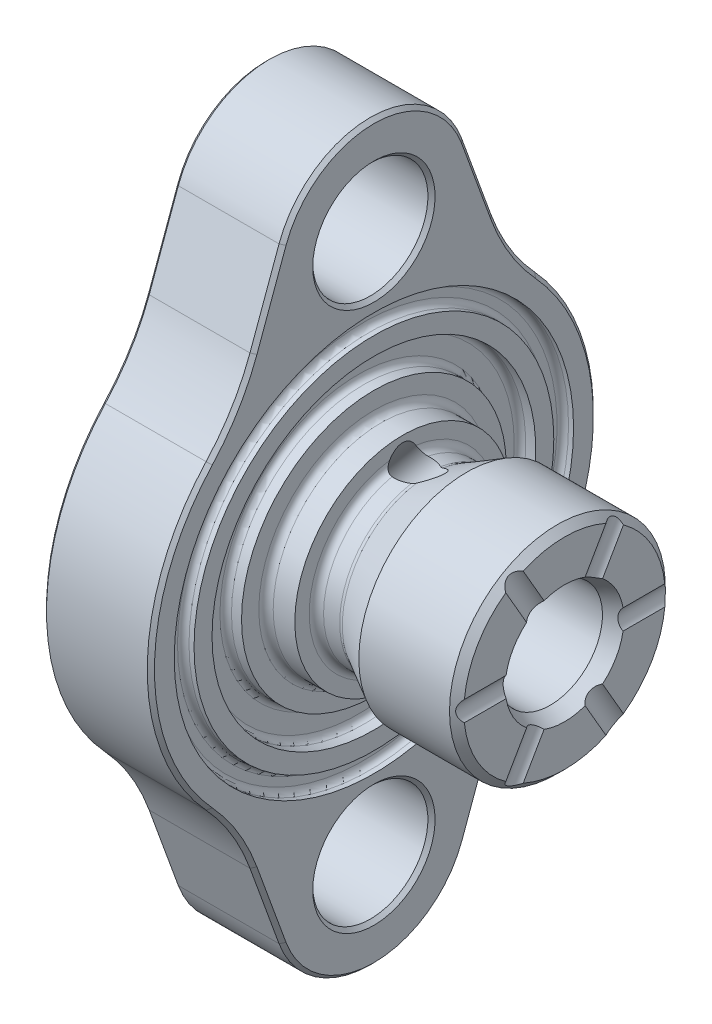
from build123d import *

# Parameters (mm, degrees)
SKETCH2_OUTSIDE_W  = 137.836
SKETCH2_OUTSIDE_H  = 137.836
CUT_EXTRUDE1_DEPTH = 86.057333605
SKETCH3_R          = 8
CUT_EXTRUDE2_DEPTH = 73.692846966
CHAMFER2_SIZE      = 1
CUT_EXTRUDE4_DEPTH = 73.692846966
CIRPATTERN1_COUNT  = 6
CIRPATTERN2_COUNT  = 2
SKETCH13_W         = 0.307692308
SKETCH13_H         = 1.153846154
SKETCH13_W_2       = 0.307692307
EXTRUDE1_DEPTH     = 0.1
CHAMFER3_SIZE      = 0.5


with BuildPart() as part:
    # Sketch1 → Revolve1 (revolve)
    with BuildSketch(Plane.XY):
        with BuildLine():
            Line((0, 0), (0, 52.5))
            Line((0, 52.5), (15, 52.5))
            Line((15, 52.5), (15, 27.75))
            Line((15, 27.75), (14.3, 27.75))
            ThreePointArc((14.3, 27.75), (13.734314575, 27.515685425), (13.5, 26.95))
            Line((13.5, 26.95), (13.5, 25.8))
            ThreePointArc((13.5, 25.8), (13.734314575, 25.234314575), (14.3, 25))
            Line((14.3, 25), (15, 25))
            Line((15, 25), (15, 22.5))
            Line((15, 22.5), (13.6, 22.5))
            ThreePointArc((13.6, 22.5), (13.034314575, 22.265685425), (12.8, 21.7))
            Line((12.8, 21.7), (12.8, 19.2))
            ThreePointArc((12.8, 19.2), (13.034314575, 18.634314575), (13.6, 18.4))
            Line((13.6, 18.4), (15, 18.4))
            Line((15, 18.4), (15, 15.9975))
            ThreePointArc((15, 15.9975), (15.292893219, 15.290393219), (16, 14.9975))
            Line((16, 14.9975), (19, 14.9975))
            Line((19, 14.9975), (19, 13))
            ThreePointArc((19, 13), (19.292893219, 12.292893219), (20, 12))
            Line((20, 12), (22.241062764, 12))
            ThreePointArc((22.241062764, 12), (22.491732804, 12.031927414), (22.726396351, 12.125670937))
            Line((22.726396351, 12.125670937), (27.9, 14.9975))
            Line((27.9, 14.9975), (41.5, 14.9975))
            Line((41.5, 14.9975), (41.5, 8.25))
            Line((41.5, 8.25), (39.5, 7.265))
            Line((39.5, 7.265), (30, 7.265))
            Line((30, 7.265), (30, 7.5))
            Line((30, 7.5), (28.5, 7.5))
            Line((28.5, 7.5), (27.90815229, 6.515))
            Line((27.90815229, 6.515), (19, 6.515))
            Line((19, 6.515), (19, 6.9))
            Line((19, 6.9), (12.5, 6.9))
            Line((12.5, 6.9), (8.516283143, 0))
            Line((8.516283143, 0), (0, 0))
        make_face()
    revolve(axis=Axis((0, 0, 0), (1, 0, 0)))

    # Sketch2 outside → Cut-Extrude1 (cut, through all)
    with BuildSketch(Plane.ZY):
        Rectangle(SKETCH2_OUTSIDE_W, SKETCH2_OUTSIDE_H)
        with BuildLine():
            Line((12.685850381, 42.117271935), (16.72864246, 31.009791985))
            ThreePointArc((16.72864246, 31.009791985), (19.282353353, 25.690256421), (22.827902518, 20.973480079))
            ThreePointArc((22.827902518, 20.973480079), (31, 0), (22.827902518, -20.973480079))
            ThreePointArc((22.827902518, -20.973480079), (19.282353353, -25.690256421), (16.72864246, -31.009791985))
            Line((16.72864246, -31.009791985), (12.685850381, -42.117271935))
            ThreePointArc((12.685850381, -42.117271935), (0, -51), (-12.685850381, -42.117271935))
            Line((-12.685850381, -42.117271935), (-16.72864246, -31.009791985))
            ThreePointArc((-16.72864246, -31.009791985), (-19.282353353, -25.690256421), (-22.827902518, -20.973480079))
            ThreePointArc((-22.827902518, -20.973480079), (-31, 0), (-22.827902518, 20.973480079))
            ThreePointArc((-22.827902518, 20.973480079), (-19.282353353, 25.690256421), (-16.72864246, 31.009791985))
            Line((-16.72864246, 31.009791985), (-12.685850381, 42.117271935))
            ThreePointArc((-12.685850381, 42.117271935), (0, 51), (12.685850381, 42.117271935))
        make_face(mode=Mode.SUBTRACT)
    extrude(amount=-CUT_EXTRUDE1_DEPTH, mode=Mode.SUBTRACT)

    # Sketch3 → Cut-Extrude2 (cut, through all)
    with BuildSketch(Plane.ZY):
        with Locations((0, 37.5)):
            Circle(SKETCH3_R)
    cut_extrude2 = extrude(amount=-CUT_EXTRUDE2_DEPTH, mode=Mode.SUBTRACT)

    # Mirror1: Cut-Extrude2 across plane
    add(cut_extrude2.mirror(Plane.ZX), mode=Mode.SUBTRACT)

    # Chamfer2
    chamfer2_edges = [part.edges().sort_by_distance(p)[0] for p in [
        (41.5, -14.9975, 0),
    ]]
    chamfer(chamfer2_edges, length=CHAMFER2_SIZE)

    # Sketch8 → Cut-Extrude4 (cut, through all)
    with BuildSketch(Plane.XY):
        with BuildLine():
            Line((45.418346774, -1.4), (41.5, -1.4))
            ThreePointArc((41.5, -1.4), (40.928285686, 0), (41.5, 1.4))
            Line((41.5, 1.4), (45.418346774, 1.4))
            Line((45.418346774, 1.4), (45.418346774, -1.4))
        make_face()
    cut_extrude4 = extrude(amount=-CUT_EXTRUDE4_DEPTH, mode=Mode.SUBTRACT)

    # CirPattern1: Cut-Extrude4 ×6 about axis
    cirpattern1_axis = Axis((30, 0, 0), (1, 0, 0))
    for i in range(1, CIRPATTERN1_COUNT):
        add(cut_extrude4.rotate(cirpattern1_axis, i * 360 / CIRPATTERN1_COUNT), mode=Mode.SUBTRACT)

    # Sketch14 → Cut-Revolve1 (revolve, cut)
    with BuildSketch(Plane.XY):
        Polygon((25.804414216, 14.432245132), (15.582644358, 2.25041418), (12.319126134, 2.25041418), (23.889303109, 16.039214156), align=None)
    cut_revolve1 = revolve(axis=Axis((23.889303109, 16.039214156, 0), (-0.6427876096865435, -0.7660444431189747, 0)), mode=Mode.SUBTRACT)

    # CirPattern2: Cut-Revolve1 ×2 about axis
    cirpattern2_axis = Axis((30, 0, 0), (1, 0, 0))
    for i in range(1, CIRPATTERN2_COUNT):
        add(cut_revolve1.rotate(cirpattern2_axis, i * 360 / CIRPATTERN2_COUNT), mode=Mode.SUBTRACT)

    # Sketch13 → Extrude1 (cut)
    # profile 1 of 21: a face of its own
    with BuildSketch(Plane.ZY):
        Polygon((11, 15.192420562), (11, 13.346266716), (7.923076923, 14.923189793), (8.051081731, 15.155761908), (10.692307692, 13.801795562), (10.692307692, 15.192420562), align=None)
    # profile 2 of 21: a face of its own
    with BuildSketch(Plane.ZY):
        with BuildLine():
            Line((10.307692308, 12.692420562), (10.307692308, 12.961651331))
            add(Edge.make_bspline(
                [(10.307692308, 12.961651331), (10.33789158, 12.95435743), (10.396928686, 12.940098451), (10.481277767, 12.910357674), (10.561097928, 12.877958313), (10.634894563, 12.839053366), (10.704150765, 12.796617291), (10.767295729, 12.747997815), (10.825935414, 12.695438053), (10.877975332, 12.637302382), (10.925099099, 12.576334958), (10.96527772, 12.511676712), (10.99984128, 12.444628518), (11.028315764, 12.374725832), (11.049766213, 12.301760542), (11.065329189, 12.226392294), (11.075435859, 12.148423579), (11.076422227, 12.095497073), (11.076923077, 12.068622485)],
                knots=[0, 0, 0, 0, 1.162005537, 2.271625781, 3.343758855, 4.383309926, 5.390229558, 6.379919256, 7.361854164, 8.333198761, 9.295911338, 10.242430842, 11.177959212, 12.116337295, 13.062827104, 14.020064771, 14.994644689, 16, 16, 16, 16], degree=3))
            add(Edge.make_bspline(
                [(11.076923077, 12.068622485), (11.07574088, 12.029465849), (11.073402272, 11.952006697), (11.052047041, 11.838209799), (11.01825407, 11.728472526), (10.971562304, 11.623996028), (10.913973178, 11.526951657), (10.845431975, 11.440606354), (10.767261146, 11.366130487), (10.680918948, 11.303649592), (10.588642797, 11.254728164), (10.493671233, 11.21865413), (10.396229544, 11.196692689), (10.33043759, 11.193846498), (10.297475962, 11.192420562)],
                knots=[0, 0, 0, 0, 1.083050992, 2.142477498, 3.193116406, 4.255571735, 5.30263384, 6.308962982, 7.297363603, 8.282367274, 9.249857812, 10.179914175, 11.08814088, 12, 12, 12, 12], degree=3))
            add(Edge.make_bspline(
                [(10.297475962, 11.192420562), (10.265755852, 11.193417926), (10.203684519, 11.195369612), (10.113066093, 11.211941359), (10.027659007, 11.239829585), (9.947103725, 11.27846081), (9.871911006, 11.328467853), (9.801911671, 11.38904445), (9.736795249, 11.46061816), (9.699492844, 11.51485725), (9.680288462, 11.542781139)],
                knots=[0, 0, 0, 0, 1.024540389, 2.004866551, 2.965041327, 3.920577974, 4.882998113, 5.874504559, 6.905732034, 8, 8, 8, 8], degree=3))
            add(Edge.make_bspline(
                [(9.680288462, 11.542781139), (9.6648786, 11.510868206), (9.634347208, 11.447639457), (9.574470844, 11.361453289), (9.505336832, 11.28321511), (9.451385987, 11.239583351), (9.424278846, 11.217660946)],
                knots=[0, 0, 0, 0, 1.015518401, 2.012035669, 3.001164323, 4, 4, 4, 4], degree=3))
            add(Edge.make_bspline(
                [(9.424278846, 11.217660946), (9.404517165, 11.203219634), (9.365317415, 11.174573496), (9.302255422, 11.139314598), (9.238703223, 11.106962184), (9.172162029, 11.083151743), (9.10476926, 11.062604276), (9.035081767, 11.049084727), (8.963761641, 11.040405717), (8.915490179, 11.039187007), (8.891225962, 11.038574408)],
                knots=[0, 0, 0, 0, 1.02516404, 2.033540309, 3.025129118, 4.011046665, 4.991655828, 5.976607087, 6.982917762, 8, 8, 8, 8], degree=3))
            add(Edge.make_bspline(
                [(8.891225962, 11.038574408), (8.8492193, 11.040115949), (8.76540366, 11.043191778), (8.641543127, 11.070573037), (8.520676779, 11.113266246), (8.404595461, 11.172834133), (8.296212681, 11.246535258), (8.199679513, 11.334703549), (8.1161433, 11.435195649), (8.046571888, 11.547353858), (7.99091776, 11.668815016), (7.952299868, 11.798739854), (7.927145399, 11.93523911), (7.924448187, 12.028845474), (7.923076923, 12.076434985)],
                knots=[0, 0, 0, 0, 0.95570045, 1.906903359, 2.87519758, 3.868912786, 4.869932978, 5.851730567, 6.836639976, 7.83677598, 8.849487602, 9.869908895, 10.917060885, 12, 12, 12, 12], degree=3))
            add(Edge.make_bspline(
                [(7.923076923, 12.076434985), (7.923821106, 12.108508671), (7.925285409, 12.171618989), (7.935295639, 12.264399131), (7.953578501, 12.352960587), (7.978181334, 12.4374231), (8.009374256, 12.517861703), (8.048218854, 12.594030936), (8.093914427, 12.666399416), (8.14700036, 12.734284231), (8.206384365, 12.797677289), (8.273120659, 12.85489391), (8.345975577, 12.906888018), (8.425795339, 12.952267423), (8.511548417, 12.993099096), (8.604332844, 13.026682773), (8.703319149, 13.056241832), (8.772300069, 13.069984802), (8.807692308, 13.077035946)],
                knots=[0, 0, 0, 0, 1.048658725, 2.063410685, 3.046034179, 4.001477787, 4.936774919, 5.862367409, 6.792675028, 7.730719943, 8.675894397, 9.627829632, 10.600096036, 11.597688215, 12.626045268, 13.701542398, 14.82072376, 16, 16, 16, 16], degree=3))
            Line((8.807692308, 13.077035946), (8.807692308, 12.807805177))
            add(Edge.make_bspline(
                [(8.807692308, 12.807805177), (8.784593153, 12.800790927), (8.739663292, 12.787147602), (8.675000173, 12.763923918), (8.615721842, 12.737465399), (8.561393451, 12.709081492), (8.511479963, 12.679271395), (8.467301219, 12.645915745), (8.42691676, 12.611485049), (8.404164235, 12.585531318), (8.393028846, 12.572829216)],
                knots=[0, 0, 0, 0, 1.198163088, 2.33053128, 3.407730985, 4.417276592, 5.372219308, 6.28897303, 7.162600585, 8, 8, 8, 8], degree=3))
            add(Edge.make_bspline(
                [(8.393028846, 12.572829216), (8.380078846, 12.55603215), (8.354218818, 12.522489868), (8.321217423, 12.467831384), (8.292622258, 12.410347196), (8.27077909, 12.348791761), (8.252283952, 12.284493386), (8.24018065, 12.216412787), (8.231876503, 12.145150601), (8.231143705, 12.096492518), (8.230769231, 12.071627293)],
                knots=[0, 0, 0, 0, 0.946170439, 1.889420265, 2.845303464, 3.807233317, 4.801018734, 5.828864929, 6.890507805, 8, 8, 8, 8], degree=3))
            add(Edge.make_bspline(
                [(8.230769231, 12.071627293), (8.231296291, 12.043552482), (8.232326912, 11.988654613), (8.24183237, 11.908555757), (8.25561558, 11.832330403), (8.277175201, 11.760756429), (8.303039527, 11.692859891), (8.336900678, 11.630156434), (8.375141373, 11.570802656), (8.419622657, 11.516537346), (8.467702109, 11.467614515), (8.518710124, 11.425339785), (8.57106512, 11.388725033), (8.625988434, 11.359292883), (8.682941311, 11.336010671), (8.742136929, 11.32017068), (8.803076821, 11.309154363), (8.844501736, 11.308257366), (8.865384615, 11.307805177)],
                knots=[0, 0, 0, 0, 1.216990249, 2.379719373, 3.493992396, 4.571561497, 5.616923107, 6.638958652, 7.655775068, 8.674704564, 9.676001865, 10.625896028, 11.54399481, 12.441854662, 13.322657739, 14.20572845, 15.095482574, 16, 16, 16, 16], degree=3))
            add(Edge.make_bspline(
                [(8.865384615, 11.307805177), (8.893337223, 11.309116841), (8.94910335, 11.311733642), (9.031146512, 11.331712773), (9.110196997, 11.364573296), (9.184894729, 11.410583637), (9.254158865, 11.466565304), (9.315717703, 11.531976398), (9.367023445, 11.606977373), (9.402340393, 11.676451096), (9.425877654, 11.738137099), (9.442381541, 11.790821847), (9.455574456, 11.849856204), (9.468335977, 11.914531475), (9.479034427, 11.985120427), (9.487994798, 12.061686657), (9.49515324, 12.144260969), (9.498351754, 12.20142471), (9.5, 12.2308821)],
                knots=[0, 0, 0, 0, 1.070481957, 2.135637345, 3.216366529, 4.339485895, 5.485746587, 6.620975969, 7.768829582, 8.956804399, 9.598399438, 10.297751078, 11.070570279, 11.915248466, 12.824061284, 13.805856426, 14.869322739, 16, 16, 16, 16], degree=3))
            Line((9.5, 12.2308821), (9.807692308, 12.2308821))
            add(Edge.make_bspline(
                [(9.807692308, 12.2308821), (9.808324886, 12.193767841), (9.80956395, 12.121070125), (9.824446445, 12.014860566), (9.845265096, 11.913177467), (9.87641744, 11.818341859), (9.913809143, 11.732184422), (9.955971019, 11.657025552), (10.003738533, 11.594646482), (10.056484782, 11.544891366), (10.113716361, 11.508372877), (10.172742216, 11.480962134), (10.234935682, 11.464892846), (10.277355669, 11.462735641), (10.298677885, 11.461651331)],
                knots=[0, 0, 0, 0, 1.321708579, 2.588902423, 3.815526512, 5.016621128, 6.138757764, 7.158873101, 8.079948563, 8.928590313, 9.728601868, 10.489025425, 11.240515403, 12, 12, 12, 12], degree=3))
            add(Edge.make_bspline(
                [(10.298677885, 11.461651331), (10.314344561, 11.462006499), (10.345512671, 11.462713089), (10.391047891, 11.471625648), (10.435193622, 11.485015418), (10.477749556, 11.503435292), (10.518468679, 11.528045033), (10.557400946, 11.55758492), (10.59519882, 11.59206921), (10.630054006, 11.632399151), (10.662931371, 11.676060613), (10.69135263, 11.723464424), (10.715442471, 11.773565033), (10.735345814, 11.826408513), (10.750308307, 11.882206553), (10.761054045, 11.940685936), (10.767771832, 12.001961239), (10.768739073, 12.04376556), (10.769230769, 12.065016716)],
                knots=[0, 0, 0, 0, 0.884317272, 1.759307272, 2.611736065, 3.488921043, 4.37244062, 5.294096728, 6.247679003, 7.258495569, 8.302441962, 9.333537773, 10.376747089, 11.440883505, 12.520330301, 13.637364711, 14.798958396, 16, 16, 16, 16], degree=3))
            add(Edge.make_bspline(
                [(10.769230769, 12.065016716), (10.768040487, 12.099176417), (10.765715588, 12.165898259), (10.745280774, 12.262066746), (10.712903918, 12.351376084), (10.673808961, 12.419411784), (10.635349996, 12.469736994), (10.602263749, 12.506388398), (10.564750721, 12.541724106), (10.521781972, 12.574357512), (10.474835025, 12.60624408), (10.423651312, 12.63707934), (10.367501106, 12.665872864), (10.328014664, 12.683399953), (10.307692308, 12.692420562)],
                knots=[0, 0, 0, 0, 1.4727372, 2.876598283, 4.222346151, 5.558423782, 6.24313385, 6.953189256, 7.68715613, 8.463578749, 9.278833271, 10.135787152, 11.040551781, 12, 12, 12, 12], degree=3))
        make_face()
    # profile 3 of 21: a face of its own
    with BuildSketch(Plane.ZY):
        Polygon((11, 10.577035946), (11, 8.7308821), (7.923076923, 10.307805177), (8.051081731, 10.540377293), (10.692307692, 9.186410946), (10.692307692, 10.577035946), align=None)
    # profile 4 of 21: a face of its own
    with BuildSketch(Plane.ZY):
        with BuildLine():
            Line((10.076923077, 8.077035946), (10.076923077, 8.346266716))
            add(Edge.make_bspline(
                [(10.076923077, 8.346266716), (10.112641157, 8.344512312), (10.182790515, 8.341066709), (10.285065658, 8.324923949), (10.382835931, 8.301847064), (10.475263133, 8.269141735), (10.563451385, 8.228753511), (10.64622965, 8.179306637), (10.724419491, 8.12185524), (10.796540515, 8.056504717), (10.862468149, 7.985593377), (10.920002504, 7.909546089), (10.968057234, 7.829144474), (11.008448343, 7.745085904), (11.038729962, 7.656398214), (11.061208295, 7.56392916), (11.074730156, 7.467260793), (11.076183786, 7.401397991), (11.076923077, 7.367901331)],
                knots=[0, 0, 0, 0, 1.100776268, 2.161895295, 3.184016182, 4.190939212, 5.176500551, 6.166955529, 7.155448256, 8.160289653, 9.16017456, 10.133824356, 11.091467644, 12.04088621, 13.000931625, 13.972173743, 14.968683325, 16, 16, 16, 16], degree=3))
            add(Edge.make_bspline(
                [(11.076923077, 7.367901331), (11.076152971, 7.335005839), (11.074639742, 7.270367372), (11.061644574, 7.176028503), (11.041291209, 7.086219393), (11.012735138, 7.001115593), (10.974348486, 6.921396109), (10.92823631, 6.846462071), (10.874905026, 6.775421376), (10.812116043, 6.711472704), (10.745085428, 6.652751494), (10.673524368, 6.602092418), (10.599613551, 6.558709706), (10.522789379, 6.522548838), (10.442328497, 6.49592929), (10.359402323, 6.475719397), (10.273152485, 6.4642959), (10.214775438, 6.46254268), (10.185096154, 6.461651331)],
                knots=[0, 0, 0, 0, 1.111607364, 2.184268762, 3.212621178, 4.221274766, 5.211760367, 6.196651075, 7.1921475, 8.207485113, 9.220403448, 10.201281604, 11.166441695, 12.114753415, 13.065576456, 14.026450734, 14.996634279, 16, 16, 16, 16], degree=3))
            add(Edge.make_bspline(
                [(10.185096154, 6.461651331), (10.143312296, 6.463102699), (10.060477827, 6.465979966), (9.938750802, 6.490592289), (9.820813585, 6.529032155), (9.725895898, 6.575315604), (9.649410046, 6.622006271), (9.58643687, 6.664081277), (9.518632183, 6.713336829), (9.446223037, 6.770489828), (9.368642261, 6.834358004), (9.285936722, 6.905519858), (9.198960919, 6.984482843), (9.139556118, 7.039904415), (9.108774038, 7.068622485)],
                knots=[0, 0, 0, 0, 1.184426356, 2.348067706, 3.509069118, 4.696110526, 5.333549288, 6.050745305, 6.844228056, 7.710549037, 8.667450064, 9.695053472, 10.805634456, 12, 12, 12, 12], degree=3))
            Line((9.108774038, 7.068622485), (8.307692308, 7.819223446))
            Line((8.307692308, 7.819223446), (8.307692308, 6.423189793))
            Line((8.307692308, 6.423189793), (8, 6.423189793))
            Line((8, 6.423189793), (8, 8.461651331))
            Line((8, 8.461651331), (9.241586538, 7.298189793))
            add(Edge.make_bspline(
                [(9.241586538, 7.298189793), (9.271154903, 7.269861027), (9.327949679, 7.215447266), (9.410893435, 7.138517157), (9.487751152, 7.069310406), (9.558863403, 7.007781105), (9.62382705, 6.953878627), (9.683151197, 6.907775437), (9.736326742, 6.869267767), (9.798795148, 6.828457661), (9.875155888, 6.789542516), (9.968003312, 6.755340086), (10.06379382, 6.734634401), (10.128506606, 6.732137874), (10.161057692, 6.7308821)],
                knots=[0, 0, 0, 0, 1.329530082, 2.553755191, 3.672934919, 4.687409497, 5.60679272, 6.413407421, 7.126401618, 7.737995624, 8.834647426, 9.90044882, 10.943907757, 12, 12, 12, 12], degree=3))
            add(Edge.make_bspline(
                [(10.161057692, 6.7308821), (10.181529724, 6.731421425), (10.221876168, 6.73248433), (10.280991506, 6.742042669), (10.338236247, 6.756085767), (10.3929026, 6.777730519), (10.446065747, 6.803735891), (10.496109363, 6.836959671), (10.544739314, 6.874925728), (10.59028812, 6.918964491), (10.6320179, 6.967310871), (10.66898061, 7.018393315), (10.699871483, 7.072435829), (10.725194425, 7.129213192), (10.745059052, 7.18856642), (10.758823545, 7.250610496), (10.767465675, 7.315173936), (10.768634965, 7.35925979), (10.769230769, 7.381723446)],
                knots=[0, 0, 0, 0, 0.991504627, 1.954065223, 2.895985987, 3.842598665, 4.797835564, 5.759220273, 6.74786863, 7.784730864, 8.824135544, 9.839918996, 10.835834653, 11.835434876, 12.84861661, 13.863796685, 14.911511676, 16, 16, 16, 16], degree=3))
            add(Edge.make_bspline(
                [(10.769230769, 7.381723446), (10.76861807, 7.405184264), (10.767414829, 7.451257437), (10.758992773, 7.518900845), (10.744477339, 7.583436889), (10.724576987, 7.644996208), (10.699522285, 7.703638114), (10.667713455, 7.758832367), (10.630392431, 7.811082872), (10.5878485, 7.860293664), (10.540258071, 7.90551066), (10.487860271, 7.94607398), (10.430314258, 7.980670204), (10.368919822, 8.0113382), (10.302044563, 8.034803755), (10.231309021, 8.054861886), (10.155708214, 8.069432635), (10.10362097, 8.074459415), (10.076923077, 8.077035946)],
                knots=[0, 0, 0, 0, 1.031212865, 2.025131798, 2.990757446, 3.934781266, 4.865570067, 5.788494791, 6.729227313, 7.684356718, 8.643577152, 9.610526866, 10.590658432, 11.59095419, 12.621640561, 13.700587263, 14.82141059, 16, 16, 16, 16], degree=3))
        make_face()
    # profile 5 of 21: a face of its own
    with BuildSketch(Plane.ZY):
        with BuildLine():
            Line((10.076923077, 4.615497485), (10.076923077, 4.884728254))
            add(Edge.make_bspline(
                [(10.076923077, 4.884728254), (10.112641157, 4.88297385), (10.182790515, 4.879528248), (10.285065658, 4.863385488), (10.382835931, 4.840308603), (10.475263133, 4.807603273), (10.563451385, 4.767215049), (10.64622965, 4.717768175), (10.724419491, 4.660316778), (10.796540515, 4.594966256), (10.862468149, 4.524054915), (10.920002504, 4.448007627), (10.968057234, 4.367606013), (11.008448343, 4.283547442), (11.038729962, 4.194859752), (11.061208295, 4.102390699), (11.074730156, 4.005722331), (11.076183786, 3.939859529), (11.076923077, 3.906362869)],
                knots=[0, 0, 0, 0, 1.100776268, 2.161895295, 3.184016182, 4.190939212, 5.176500551, 6.166955529, 7.155448256, 8.160289653, 9.16017456, 10.133824356, 11.091467644, 12.04088621, 13.000931625, 13.972173743, 14.968683325, 16, 16, 16, 16], degree=3))
            add(Edge.make_bspline(
                [(11.076923077, 3.906362869), (11.076152971, 3.873467377), (11.074639742, 3.808828911), (11.061644574, 3.714490041), (11.041291209, 3.624680931), (11.012735138, 3.539577132), (10.974348486, 3.459857648), (10.92823631, 3.384923609), (10.874905026, 3.313882915), (10.812116043, 3.249934243), (10.745085428, 3.191213032), (10.673524368, 3.140553956), (10.599613551, 3.097171245), (10.522789379, 3.061010376), (10.442328497, 3.034390829), (10.359402323, 3.014180936), (10.273152485, 3.002757439), (10.214775438, 3.001004218), (10.185096154, 3.000112869)],
                knots=[0, 0, 0, 0, 1.111607364, 2.184268762, 3.212621178, 4.221274766, 5.211760367, 6.196651075, 7.1921475, 8.207485113, 9.220403448, 10.201281604, 11.166441695, 12.114753415, 13.065576456, 14.026450734, 14.996634279, 16, 16, 16, 16], degree=3))
            add(Edge.make_bspline(
                [(10.185096154, 3.000112869), (10.143312296, 3.001564238), (10.060477827, 3.004441504), (9.938750802, 3.029053827), (9.820813585, 3.067493694), (9.725895898, 3.113777143), (9.649410046, 3.160467809), (9.58643687, 3.202542815), (9.518632183, 3.251798368), (9.446223037, 3.308951366), (9.368642261, 3.372819542), (9.285936722, 3.443981396), (9.198960919, 3.522944381), (9.139556118, 3.578365953), (9.108774038, 3.607084023)],
                knots=[0, 0, 0, 0, 1.184426356, 2.348067706, 3.509069118, 4.696110526, 5.333549288, 6.050745305, 6.844228056, 7.710549037, 8.667450064, 9.695053472, 10.805634456, 12, 12, 12, 12], degree=3))
            Line((9.108774038, 3.607084023), (8.307692308, 4.357684985))
            Line((8.307692308, 4.357684985), (8.307692308, 2.961651331))
            Line((8.307692308, 2.961651331), (8, 2.961651331))
            Line((8, 2.961651331), (8, 5.000112869))
            Line((8, 5.000112869), (9.241586538, 3.836651331))
            add(Edge.make_bspline(
                [(9.241586538, 3.836651331), (9.271154903, 3.808322565), (9.327949679, 3.753908804), (9.410893435, 3.676978695), (9.487751152, 3.607771944), (9.558863403, 3.546242643), (9.62382705, 3.492340166), (9.683151197, 3.446236975), (9.736326742, 3.407729305), (9.798795148, 3.366919199), (9.875155888, 3.328004055), (9.968003312, 3.293801625), (10.06379382, 3.273095939), (10.128506606, 3.270599413), (10.161057692, 3.269343639)],
                knots=[0, 0, 0, 0, 1.329530082, 2.553755191, 3.672934919, 4.687409497, 5.60679272, 6.413407421, 7.126401618, 7.737995624, 8.834647426, 9.90044882, 10.943907757, 12, 12, 12, 12], degree=3))
            add(Edge.make_bspline(
                [(10.161057692, 3.269343639), (10.181529724, 3.269882963), (10.221876168, 3.270945868), (10.280991506, 3.280504208), (10.338236247, 3.294547305), (10.3929026, 3.316192057), (10.446065747, 3.342197429), (10.496109363, 3.37542121), (10.544739314, 3.413387266), (10.59028812, 3.45742603), (10.6320179, 3.505772409), (10.66898061, 3.556854854), (10.699871483, 3.610897367), (10.725194425, 3.667674731), (10.745059052, 3.727027959), (10.758823545, 3.789072035), (10.767465675, 3.853635475), (10.768634965, 3.897721329), (10.769230769, 3.920184985)],
                knots=[0, 0, 0, 0, 0.991504627, 1.954065223, 2.895985987, 3.842598665, 4.797835564, 5.759220273, 6.74786863, 7.784730864, 8.824135544, 9.839918996, 10.835834653, 11.835434876, 12.84861661, 13.863796685, 14.911511676, 16, 16, 16, 16], degree=3))
            add(Edge.make_bspline(
                [(10.769230769, 3.920184985), (10.76861807, 3.943645803), (10.767414829, 3.989718975), (10.758992773, 4.057362384), (10.744477339, 4.121898427), (10.724576987, 4.183457746), (10.699522285, 4.242099652), (10.667713455, 4.297293905), (10.630392431, 4.34954441), (10.5878485, 4.398755202), (10.540258071, 4.443972199), (10.487860271, 4.484535519), (10.430314258, 4.519131743), (10.368919822, 4.549799738), (10.302044563, 4.573265294), (10.231309021, 4.593323425), (10.155708214, 4.607894174), (10.10362097, 4.612920953), (10.076923077, 4.615497485)],
                knots=[0, 0, 0, 0, 1.031212865, 2.025131798, 2.990757446, 3.934781266, 4.865570067, 5.788494791, 6.729227313, 7.684356718, 8.643577152, 9.610526866, 10.590658432, 11.59095419, 12.621640561, 13.700587263, 14.82141059, 16, 16, 16, 16], degree=3))
        make_face()
    # profile 6 of 21: a face of its own
    with BuildSketch(Plane.ZY):
        with BuildLine():
            Line((7.923076923, 2.038574408), (8.072716346, 2.253718639))
            Line((8.072716346, 2.253718639), (9.292067308, 1.419584023))
            add(Edge.make_bspline(
                [(9.292067308, 1.419584023), (9.285558968, 1.472804654), (9.272743683, 1.577599042), (9.270389408, 1.68314513), (9.269230769, 1.735088831)],
                knots=[0, 0, 0, 0, 1.015715272, 2, 2, 2, 2], degree=3))
            add(Edge.make_bspline(
                [(9.269230769, 1.735088831), (9.270039798, 1.766581144), (9.271627852, 1.8283978), (9.284143952, 1.919294463), (9.303639241, 2.006764718), (9.332054957, 2.090475391), (9.368370988, 2.170351907), (9.412608653, 2.246673002), (9.464932616, 2.319337617), (9.524780446, 2.387490709), (9.590506905, 2.44947116), (9.660068258, 2.5046914), (9.734276395, 2.550583729), (9.81161654, 2.588706535), (9.893200567, 2.617618347), (9.978100049, 2.638671952), (10.066910029, 2.65163397), (10.127360141, 2.653176052), (10.158052885, 2.653959023)],
                knots=[0, 0, 0, 0, 1.060702494, 2.082066239, 3.085748733, 4.076089625, 5.054723785, 6.037561548, 7.043420247, 8.066922603, 9.088643095, 10.08373341, 11.053858765, 12.022809492, 12.983497605, 13.964038393, 14.966267459, 16, 16, 16, 16], degree=3))
            add(Edge.make_bspline(
                [(10.158052885, 2.653959023), (10.200026016, 2.652472365), (10.282410757, 2.649554356), (10.402782559, 2.626069913), (10.516599596, 2.587446765), (10.62356262, 2.53359387), (10.722132968, 2.465764109), (10.810940347, 2.384242461), (10.88872165, 2.289524777), (10.955582288, 2.18376876), (11.009355143, 2.069466171), (11.048988829, 1.949750179), (11.072302041, 1.825538076), (11.075375636, 1.741394358), (11.076923077, 1.699031139)],
                knots=[0, 0, 0, 0, 1.022988612, 2.007919123, 2.978103895, 3.94594894, 4.918897164, 5.887013414, 6.875921846, 7.89917871, 8.930658928, 9.948724884, 10.967259574, 12, 12, 12, 12], degree=3))
            add(Edge.make_bspline(
                [(11.076923077, 1.699031139), (11.075360003, 1.657468017), (11.072271516, 1.575343205), (11.049453725, 1.454416979), (11.011406564, 1.338493096), (10.958586228, 1.228483625), (10.891948047, 1.127153249), (10.813197958, 1.035683407), (10.721448623, 0.956524586), (10.619209657, 0.88981286), (10.509350018, 0.836268596), (10.394678669, 0.797634821), (10.276016756, 0.773852946), (10.195621513, 0.770856081), (10.155048077, 0.769343639)],
                knots=[0, 0, 0, 0, 1.026337322, 2.02794581, 3.027878252, 4.032696425, 5.033228651, 6.015458494, 7.004668777, 8.016190509, 9.023163053, 10.0152653, 10.998354841, 12, 12, 12, 12], degree=3))
            add(Edge.make_bspline(
                [(10.155048077, 0.769343639), (10.123550898, 0.770341227), (10.059666749, 0.772364587), (9.962698243, 0.786900243), (9.863622273, 0.810442431), (9.779653583, 0.837750366), (9.711006066, 0.865713769), (9.655914697, 0.889772604), (9.598422542, 0.917775248), (9.538952146, 0.951038286), (9.475938848, 0.985813587), (9.410758782, 1.025353747), (9.34304772, 1.068455419), (9.297408719, 1.09916906), (9.274038462, 1.114896523)],
                knots=[0, 0, 0, 0, 1.179688711, 2.392703466, 3.66501481, 4.991562144, 5.695278944, 6.441221078, 7.243328977, 8.089575748, 8.993388627, 9.939305498, 10.944784961, 12, 12, 12, 12], degree=3))
            Line((9.274038462, 1.114896523), (7.923076923, 2.038574408))
        make_face()
        with BuildLine():
            add(Edge.make_bspline(
                [(9.576923077, 1.685209023), (9.577574834, 1.661351297), (9.578843585, 1.614908414), (9.586565792, 1.546870729), (9.60025778, 1.482649984), (9.619903248, 1.422074627), (9.643608964, 1.364537283), (9.673790666, 1.310951858), (9.709804925, 1.261273508), (9.750270652, 1.215169571), (9.795228295, 1.174229), (9.842282958, 1.137763545), (9.891641195, 1.106768773), (9.943921135, 1.082285964), (9.99785017, 1.062156328), (10.054296761, 1.048255174), (10.112966818, 1.040554317), (10.152822811, 1.039241539), (10.173076923, 1.038574408)],
                knots=[0, 0, 0, 0, 1.163407946, 2.26475976, 3.333800367, 4.359385343, 5.366239384, 6.363380779, 7.350133999, 8.353570782, 9.349036268, 10.310270964, 11.253520213, 12.184142, 13.120487599, 14.056272588, 15.012232024, 16, 16, 16, 16], degree=3))
            add(Edge.make_bspline(
                [(10.173076923, 1.038574408), (10.193339538, 1.039148358), (10.233269505, 1.040279397), (10.292025789, 1.049354974), (10.348336665, 1.065316663), (10.40249619, 1.086747491), (10.454112613, 1.114925694), (10.503522613, 1.148864752), (10.551336923, 1.188395269), (10.595093039, 1.234787017), (10.635948588, 1.284700122), (10.67136601, 1.338367826), (10.701598686, 1.394458906), (10.726333068, 1.453018056), (10.745672946, 1.514167171), (10.759570849, 1.577909553), (10.76726166, 1.644556547), (10.768566039, 1.689797718), (10.769230769, 1.712853254)],
                knots=[0, 0, 0, 0, 0.972051712, 1.915547132, 2.843788449, 3.775556853, 4.704594175, 5.659091977, 6.648619647, 7.675179132, 8.714041218, 9.74046568, 10.755438548, 11.767722258, 12.786148662, 13.828784001, 14.893517844, 16, 16, 16, 16], degree=3))
            add(Edge.make_bspline(
                [(10.769230769, 1.712853254), (10.768565086, 1.735708335), (10.767259022, 1.780549816), (10.759584106, 1.846603497), (10.745584428, 1.909917895), (10.726323728, 1.970878754), (10.701733223, 2.029314474), (10.671366239, 2.084959379), (10.635759407, 2.138067846), (10.595145064, 2.187966716), (10.551126858, 2.234258993), (10.503731533, 2.274485686), (10.454086454, 2.308346101), (10.402503143, 2.336563374), (10.34833481, 2.357983809), (10.292026291, 2.373948281), (10.233269374, 2.383023111), (10.193339493, 2.384154252), (10.173076923, 2.384728254)],
                knots=[0, 0, 0, 0, 1.099545523, 2.15729926, 3.193054709, 4.213957097, 5.228701859, 6.237665598, 7.258567987, 8.299955741, 9.329010984, 10.327149711, 11.283968076, 12.215264062, 13.149297769, 14.079795814, 15.025585048, 16, 16, 16, 16], degree=3))
            add(Edge.make_bspline(
                [(10.173076923, 2.384728254), (10.152807038, 2.384208889), (10.112831116, 2.383184606), (10.054094208, 2.373303643), (9.997790042, 2.356779403), (9.94337115, 2.334648497), (9.8913667, 2.305504277), (9.842023247, 2.269740978), (9.794781432, 2.227821939), (9.750375251, 2.180307521), (9.709616243, 2.12830624), (9.674018773, 2.072766172), (9.643956678, 2.014643455), (9.619835492, 1.953733485), (9.600454066, 1.890487657), (9.586591027, 1.824337544), (9.578917655, 1.755501912), (9.577594315, 1.708864785), (9.576923077, 1.685209023)],
                knots=[0, 0, 0, 0, 0.952633368, 1.87876736, 2.791047057, 3.707742249, 4.635551637, 5.587206343, 6.568248508, 7.601284464, 8.641511608, 9.671105535, 10.699146789, 11.713763218, 12.747829548, 13.806491675, 14.887386225, 16, 16, 16, 16], degree=3))
        make_face(mode=Mode.SUBTRACT)
    # profile 7 of 21: a face of its own
    with BuildSketch(Plane.ZY):
        with BuildLine():
            Line((11.076923077, -0.999887131), (10.9140625, -1.207218861))
            Line((10.9140625, -1.207218861), (9.701923077, -0.414550592))
            add(Edge.make_bspline(
                [(9.701923077, -0.414550592), (9.710334957, -0.467325115), (9.726743282, -0.57026779), (9.729450092, -0.674467131), (9.730769231, -0.725247707)],
                knots=[0, 0, 0, 0, 1.025318673, 2, 2, 2, 2], degree=3))
            add(Edge.make_bspline(
                [(9.730769231, -0.725247707), (9.729949706, -0.755738419), (9.728336497, -0.815758476), (9.715921768, -0.903878592), (9.696357386, -0.988554823), (9.66783831, -1.069436205), (9.63140772, -1.146813047), (9.587745832, -1.221129386), (9.534598106, -1.290988252), (9.475228144, -1.357289263), (9.409470728, -1.417483918), (9.339698154, -1.47077768), (9.265983113, -1.515543501), (9.188362942, -1.551864005), (9.106957291, -1.580068187), (9.021870315, -1.600629026), (8.933043339, -1.612782962), (8.872633474, -1.614433383), (8.841947115, -1.615271746)],
                knots=[0, 0, 0, 0, 1.04369286, 2.054478336, 3.041073146, 4.015093852, 4.984733326, 5.965804835, 6.960378782, 7.985147595, 9.009457201, 10.008161701, 10.986880575, 11.956520048, 12.937015923, 13.931873656, 14.949455224, 16, 16, 16, 16], degree=3))
            add(Edge.make_bspline(
                [(8.841947115, -1.615271746), (8.799989469, -1.61370615), (8.717475431, -1.610627244), (8.596791933, -1.588214116), (8.482742142, -1.549534066), (8.374877863, -1.497784796), (8.276337412, -1.430644188), (8.187283268, -1.351078877), (8.109659499, -1.258336747), (8.043069301, -1.154613952), (7.990163473, -1.042353677), (7.951049114, -0.924645105), (7.927677291, -0.802494348), (7.924617433, -0.719537177), (7.923076923, -0.677771746)],
                knots=[0, 0, 0, 0, 1.031881447, 2.029301251, 3.006342947, 3.987068354, 4.962916383, 5.929513747, 6.915671209, 7.928552063, 8.953527267, 9.960179832, 10.973036711, 12, 12, 12, 12], degree=3))
            add(Edge.make_bspline(
                [(7.923076923, -0.677771746), (7.92438681, -0.637403138), (7.926981468, -0.557439992), (7.950095177, -0.439811997), (7.987558225, -0.326786123), (8.039171153, -0.219156847), (8.10436106, -0.119447429), (8.182852467, -0.030270562), (8.272910623, 0.048063488), (8.374811795, 0.112910223), (8.483606077, 0.165760488), (8.598081295, 0.203036544), (8.715933588, 0.227143067), (8.796157026, 0.229630181), (8.836538462, 0.2308821)],
                knots=[0, 0, 0, 0, 1.011913813, 2.004424092, 2.994488568, 3.992479987, 4.990471406, 5.973328987, 6.963763268, 7.974390938, 8.994854117, 9.989689954, 10.988086187, 12, 12, 12, 12], degree=3))
            add(Edge.make_bspline(
                [(8.836538462, 0.2308821), (8.867422569, 0.229794859), (8.930453956, 0.227575907), (9.026192904, 0.214333462), (9.12377053, 0.190045198), (9.206489661, 0.163759988), (9.274996089, 0.137677125), (9.329093805, 0.113492494), (9.386222731, 0.08645113), (9.44530193, 0.054754886), (9.508019423, 0.021154309), (9.57205259, -0.018094977), (9.639740121, -0.059052211), (9.684805427, -0.089056436), (9.707932692, -0.104454438)],
                knots=[0, 0, 0, 0, 1.17367173, 2.395347028, 3.66355231, 4.98980831, 5.690886799, 6.447442954, 7.240630024, 8.091733897, 8.994365608, 9.943299771, 10.944512865, 12, 12, 12, 12], degree=3))
            Line((9.707932692, -0.104454438), (11.076923077, -0.999887131))
        make_face()
        with BuildLine():
            add(Edge.make_bspline(
                [(9.423076923, -0.668757323), (9.422401194, -0.645904687), (9.42107542, -0.601068004), (9.413587435, -0.535369092), (9.399399758, -0.473357224), (9.381047671, -0.414324125), (9.35606002, -0.358885075), (9.326067755, -0.306407677), (9.290408913, -0.257412662), (9.24948108, -0.212760465), (9.205325571, -0.17175872), (9.157747724, -0.136490523), (9.108201124, -0.106035001), (9.056220094, -0.0812812), (9.001837977, -0.062003443), (8.945301315, -0.048059377), (8.886231953, -0.040298979), (8.846175516, -0.039007929), (8.825721154, -0.038348669)],
                knots=[0, 0, 0, 0, 1.129474985, 2.216020618, 3.260639938, 4.268601163, 5.26556745, 6.258792394, 7.250684778, 8.252748164, 9.247500881, 10.223461414, 11.174097059, 12.117127289, 13.062595836, 14.020469732, 14.98917545, 16, 16, 16, 16], degree=3))
            add(Edge.make_bspline(
                [(8.825721154, -0.038348669), (8.805450514, -0.038886934), (8.765702807, -0.03994239), (8.707115357, -0.049481781), (8.650786736, -0.064157324), (8.596675747, -0.085638431), (8.545077555, -0.11258202), (8.495625645, -0.145739077), (8.448285883, -0.184548173), (8.40425201, -0.229662978), (8.363863071, -0.27831492), (8.327900685, -0.329767572), (8.297701896, -0.383857333), (8.273827374, -0.440892845), (8.254273571, -0.500075567), (8.240503873, -0.561856983), (8.232721299, -0.626291377), (8.231428461, -0.669938681), (8.230769231, -0.692194823)],
                knots=[0, 0, 0, 0, 0.989642335, 1.94054129, 2.892446913, 3.828371744, 4.778262963, 5.730973156, 6.732161388, 7.763274768, 8.805796303, 9.818398792, 10.825975928, 11.825728216, 12.834635236, 13.867465554, 14.912602056, 16, 16, 16, 16], degree=3))
            add(Edge.make_bspline(
                [(8.230769231, -0.692194823), (8.231428409, -0.714451001), (8.232721146, -0.758098376), (8.240504454, -0.822532253), (8.254271436, -0.884315585), (8.273835111, -0.943491342), (8.297673195, -1.000552561), (8.328089915, -1.05468967), (8.363644418, -1.106633557), (8.404321524, -1.155253583), (8.448037071, -1.200556954), (8.496054274, -1.238457057), (8.544684519, -1.27266162), (8.596881363, -1.298570381), (8.650754162, -1.320290721), (8.707124083, -1.33489222), (8.765700523, -1.344451351), (8.805449743, -1.345504095), (8.825721154, -1.346040977)],
                knots=[0, 0, 0, 0, 1.087205562, 2.132157158, 3.164804748, 4.173533273, 5.173108684, 6.180507559, 7.20098426, 8.243321352, 9.274252308, 10.269075238, 11.227079059, 12.172305571, 13.108064818, 14.05980203, 15.010532752, 16, 16, 16, 16], degree=3))
            add(Edge.make_bspline(
                [(8.825721154, -1.346040977), (8.846204575, -1.345574795), (8.886406868, -1.344659831), (8.945248096, -1.334110681), (9.002297713, -1.319862298), (9.056270586, -1.296835605), (9.108659282, -1.269408935), (9.157966492, -1.234469158), (9.205589099, -1.194409849), (9.249773926, -1.148017282), (9.290188966, -1.097546322), (9.325862011, -1.043874135), (9.35596936, -0.987724887), (9.381089673, -0.929152818), (9.39921781, -0.867487522), (9.413492014, -0.803724365), (9.42108803, -0.737047874), (9.422405515, -0.691810781), (9.423076923, -0.668757323)],
                knots=[0, 0, 0, 0, 0.978265087, 1.920016216, 2.851775529, 3.783928695, 4.718195979, 5.674835085, 6.667117013, 7.690134047, 8.732874136, 9.755756613, 10.767227014, 11.776017537, 12.797239016, 13.836276431, 14.897336092, 16, 16, 16, 16], degree=3))
        make_face(mode=Mode.SUBTRACT)
    # profile 8 of 21: a face of its own
    with BuildSketch(Plane.ZY):
        with BuildLine():
            Line((11, -3.807579438), (10.692307692, -3.807579438))
            Line((10.692307692, -3.807579438), (10.692307692, -2.787146746))
            Line((10.692307692, -2.787146746), (9.903245192, -2.625488092))
            add(Edge.make_bspline(
                [(9.903245192, -2.625488092), (9.912013997, -2.65725027), (9.929002168, -2.718784467), (9.947864257, -2.809607205), (9.959234638, -2.895829093), (9.96078719, -2.951779411), (9.961538462, -2.978853477)],
                knots=[0, 0, 0, 0, 1.100273476, 2.13160584, 3.095893838, 4, 4, 4, 4], degree=3))
            add(Edge.make_bspline(
                [(9.961538462, -2.978853477), (9.960813184, -3.012353709), (9.959387107, -3.078223537), (9.945699647, -3.17460142), (9.924141356, -3.266595077), (9.894073597, -3.354047333), (9.855376794, -3.43714655), (9.807664445, -3.515428665), (9.751266572, -3.589337331), (9.686727319, -3.657895503), (9.61560935, -3.719995009), (9.539393104, -3.774810436), (9.458009254, -3.820399181), (9.371817674, -3.857905725), (9.280962984, -3.887663546), (9.184772679, -3.907524049), (9.084100359, -3.920733964), (9.015268218, -3.922210908), (8.980168269, -3.922964054)],
                knots=[0, 0, 0, 0, 1.052772836, 2.070014431, 3.053871312, 4.019926262, 4.972333346, 5.930471369, 6.896690565, 7.89035727, 8.885779078, 9.861050232, 10.836829716, 11.812751485, 12.812646763, 13.836748493, 14.896881366, 16, 16, 16, 16], degree=3))
            add(Edge.make_bspline(
                [(8.980168269, -3.922964054), (8.95572062, -3.922394066), (8.90715571, -3.921261793), (8.835032579, -3.915501878), (8.764434116, -3.904418309), (8.695361378, -3.889516234), (8.627906708, -3.870251096), (8.562094644, -3.846675979), (8.497722538, -3.818886728), (8.434786175, -3.787512004), (8.375225782, -3.751217264), (8.318121955, -3.712984992), (8.265576235, -3.670634157), (8.215670353, -3.626215177), (8.170364191, -3.57795192), (8.127718904, -3.527342401), (8.089586913, -3.473198939), (8.054514091, -3.416490905), (8.023111247, -3.357254058), (7.996915667, -3.294887748), (7.973955014, -3.230761079), (7.95528329, -3.164302496), (7.94079673, -3.095640751), (7.93093158, -3.024539401), (7.923753825, -2.951355219), (7.923304096, -2.901748168), (7.923076923, -2.876690015)],
                knots=[0, 0, 0, 0, 1.05623316, 2.098192244, 3.122504159, 4.140841222, 5.148757784, 6.150489607, 7.158294732, 8.176043417, 9.185147859, 10.169157858, 11.142149047, 12.097904048, 13.0527185, 13.998867679, 14.954465986, 15.910220987, 16.877849176, 17.847023716, 18.829548819, 19.818454515, 20.826519638, 21.858115382, 22.918063636, 24, 24, 24, 24], degree=3))
            add(Edge.make_bspline(
                [(7.923076923, -2.876690015), (7.923669122, -2.846797897), (7.924834203, -2.787988685), (7.937020736, -2.701827678), (7.954478222, -2.618931349), (7.980728043, -2.539955751), (8.013667747, -2.464234564), (8.055034258, -2.392775783), (8.102566261, -2.324174852), (8.157903772, -2.260296263), (8.218955449, -2.201129523), (8.28449812, -2.147352095), (8.354792393, -2.100189613), (8.429239827, -2.05944961), (8.507968523, -2.02474917), (8.591214063, -1.997475829), (8.678557676, -1.975466729), (8.738689153, -1.966155099), (8.769230769, -1.961425592)],
                knots=[0, 0, 0, 0, 1.046825758, 2.059506013, 3.044032586, 4.011925612, 4.970610144, 5.93275819, 6.900651216, 7.891265644, 8.889116719, 9.876966323, 10.858259055, 11.851035124, 12.847502422, 13.86866322, 14.9174643, 16, 16, 16, 16], degree=3))
            Line((8.769230769, -1.961425592), (8.769230769, -2.230656361))
            add(Edge.make_bspline(
                [(8.769230769, -2.230656361), (8.740619652, -2.23727667), (8.685627496, -2.250001271), (8.608408384, -2.278004537), (8.53933665, -2.312032618), (8.478347086, -2.353416203), (8.424883236, -2.40178357), (8.376827964, -2.456579642), (8.334048616, -2.518585061), (8.298160408, -2.587460298), (8.267598198, -2.660166344), (8.247236672, -2.736250096), (8.232922387, -2.813654456), (8.231489347, -2.866007259), (8.230769231, -2.892315015)],
                knots=[0, 0, 0, 0, 1.136389429, 2.184203582, 3.172920998, 4.111012962, 5.028380909, 5.957351669, 6.927793475, 7.937618031, 8.960409703, 9.974842029, 10.982339866, 12, 12, 12, 12], degree=3))
            add(Edge.make_bspline(
                [(8.230769231, -2.892315015), (8.231472755, -2.917993682), (8.232857999, -2.968555187), (8.243520009, -3.042964947), (8.259940785, -3.114804553), (8.284514946, -3.183365145), (8.314381848, -3.249846464), (8.352709056, -3.312566839), (8.396817643, -3.373340734), (8.447351897, -3.430279134), (8.503040207, -3.482427233), (8.562592258, -3.528503908), (8.626120984, -3.56688412), (8.692526544, -3.599227642), (8.762536735, -3.623787612), (8.835823457, -3.641308453), (8.912567726, -3.651596789), (8.964912848, -3.653012086), (8.991586538, -3.653733284)],
                knots=[0, 0, 0, 0, 1.027316725, 2.022795036, 3.002884548, 3.971462791, 4.93288096, 5.914575861, 6.907176829, 7.935150275, 8.956128384, 9.956726525, 10.942570165, 11.921478529, 12.907843606, 13.90538589, 14.932640048, 16, 16, 16, 16], degree=3))
            add(Edge.make_bspline(
                [(8.991586538, -3.653733284), (9.015665969, -3.653259782), (9.062825038, -3.652332436), (9.131515754, -3.642027352), (9.196982005, -3.627591529), (9.25863835, -3.605427163), (9.317387656, -3.578041208), (9.371972473, -3.54329685), (9.42379518, -3.503580469), (9.470750501, -3.457061603), (9.514380581, -3.406334755), (9.551519507, -3.350222387), (9.582777841, -3.290004376), (9.609749431, -3.226377684), (9.629121772, -3.157836711), (9.643665597, -3.085736636), (9.652078786, -3.009299487), (9.653246116, -2.957038893), (9.653846154, -2.930175592)],
                knots=[0, 0, 0, 0, 1.045726679, 2.048034203, 3.01323695, 3.95502507, 4.889743367, 5.8246644, 6.761650845, 7.722168973, 8.692072792, 9.66525385, 10.638902184, 11.638179751, 12.663148338, 13.728659964, 14.832472288, 16, 16, 16, 16], degree=3))
            add(Edge.make_bspline(
                [(9.653846154, -2.930175592), (9.653365403, -2.906720287), (9.652381232, -2.858703635), (9.644636009, -2.784878116), (9.632720729, -2.707636173), (9.615547008, -2.626677929), (9.594044327, -2.542225559), (9.567190174, -2.454138618), (9.536257576, -2.362414979), (9.512265199, -2.300678401), (9.5, -2.2691179)],
                knots=[0, 0, 0, 0, 0.824638674, 1.688163388, 2.607705698, 3.571998603, 4.597075385, 5.671199175, 6.809488238, 8, 8, 8, 8], degree=3))
            Line((9.5, -2.2691179), (11, -2.576810207))
            Line((11, -2.576810207), (11, -3.807579438))
        make_face()
    # profile 9 of 21: a face of its own
    with BuildSketch(Plane.ZY):
        with BuildLine():
            add(Edge.make_bspline(
                [(9.498798077, -5.384502515), (9.546881552, -5.384783674), (9.640284396, -5.385329828), (9.776385517, -5.391405617), (9.904065766, -5.401498767), (10.023331249, -5.415330803), (10.134212768, -5.43216335), (10.236413966, -5.454633792), (10.33040799, -5.48018754), (10.41650092, -5.509804201), (10.495854114, -5.543221346), (10.569929763, -5.579596954), (10.638633822, -5.620354778), (10.70299841, -5.66323503), (10.762305186, -5.70980467), (10.816441839, -5.759572501), (10.865441057, -5.813032201), (10.909886014, -5.869126458), (10.948603237, -5.928209774), (10.983490028, -5.988460805), (11.012123751, -6.05094273), (11.035651483, -6.115085695), (11.054503657, -6.180703165), (11.067558752, -6.248066265), (11.075740787, -6.317191271), (11.076525241, -6.363846263), (11.076923077, -6.387507323)],
                knots=[0, 0, 0, 0, 1.646377244, 3.198111528, 4.663803227, 6.031090796, 7.308794487, 8.502186765, 9.612154809, 10.642545331, 11.617106989, 12.558866172, 13.465886467, 14.35053239, 15.20542558, 16.045215227, 16.865619885, 17.686225247, 18.492864914, 19.282407821, 20.068097601, 20.842842034, 21.620163247, 22.403093475, 23.190129512, 24, 24, 24, 24], degree=3))
            add(Edge.make_bspline(
                [(11.076923077, -6.387507323), (11.07650495, -6.411366304), (11.075673426, -6.458814312), (11.067681475, -6.528963205), (11.054420513, -6.597491504), (11.035631106, -6.664107051), (11.012320526, -6.72935704), (10.983102997, -6.792731103), (10.949092539, -6.854622888), (10.909129216, -6.914048848), (10.864572979, -6.971661376), (10.814204977, -7.026045344), (10.758533789, -7.077205703), (10.698155049, -7.125784537), (10.63191069, -7.17040362), (10.560952882, -7.212895133), (10.484040712, -7.250928307), (10.402457454, -7.287558028), (10.313945746, -7.319175446), (10.219004523, -7.34768937), (10.116512363, -7.370728486), (10.00700701, -7.389919291), (9.89008631, -7.404786345), (9.766000897, -7.415614323), (9.634669133, -7.421334111), (9.544876691, -7.422411283), (9.498798077, -7.422964054)],
                knots=[0, 0, 0, 0, 0.810914788, 1.612654377, 2.396697861, 3.181598691, 3.963628158, 4.749916497, 5.551656086, 6.361998678, 7.18212741, 8.025565596, 8.878627764, 9.750805457, 10.657531673, 11.591944965, 12.560506719, 13.57287815, 14.630710178, 15.753379473, 16.941251878, 18.199788006, 19.531962791, 20.947069417, 22.433333509, 24, 24, 24, 24], degree=3))
            add(Edge.make_bspline(
                [(9.498798077, -7.422964054), (9.452920613, -7.422404862), (9.363530246, -7.421315301), (9.23278704, -7.415685946), (9.109368472, -7.404545043), (8.992930991, -7.390765504), (8.884165925, -7.37113674), (8.782039049, -7.348822295), (8.687431701, -7.321087836), (8.599386797, -7.289901365), (8.518203244, -7.254066472), (8.441955943, -7.215697156), (8.371056034, -7.173466464), (8.304812638, -7.128581283), (8.243910257, -7.080415364), (8.188198373, -7.02903837), (8.137713732, -6.974411197), (8.092548717, -6.916668414), (8.053050595, -6.856307599), (8.017745626, -6.794622402), (7.989097834, -6.730381641), (7.964909947, -6.665013016), (7.946077315, -6.597899731), (7.933182738, -6.529107614), (7.924114216, -6.458861959), (7.923423885, -6.411374559), (7.923076923, -6.387507323)],
                knots=[0, 0, 0, 0, 1.56130642, 3.042141888, 4.451772327, 5.777565838, 7.030558081, 8.211376819, 9.333164717, 10.383253789, 11.387583522, 12.350962576, 13.286244149, 14.193812918, 15.072134482, 15.925989337, 16.770211267, 17.600669898, 18.417446232, 19.22325363, 20.01647746, 20.807971184, 21.593601364, 22.38506573, 23.188331689, 24, 24, 24, 24], degree=3))
            add(Edge.make_bspline(
                [(7.923076923, -6.387507323), (7.923478587, -6.363847224), (7.92427059, -6.317194128), (7.932397328, -6.248055237), (7.9456493, -6.180797196), (7.963645411, -6.11528555), (7.986517401, -6.051386229), (8.015609725, -5.989725189), (8.049352296, -5.9294881), (8.087740784, -5.870949826), (8.131732992, -5.815226071), (8.180387068, -5.761997571), (8.234923354, -5.712608325), (8.294468914, -5.666622351), (8.358518504, -5.622984159), (8.42770306, -5.582625732), (8.502472754, -5.546321077), (8.582264003, -5.512155026), (8.668989672, -5.482037716), (8.763485022, -5.455635173), (8.866272778, -5.43362496), (8.977047794, -5.415924233), (9.095892981, -5.401331764), (9.223017589, -5.39145341), (9.358311937, -5.385324989), (9.45111482, -5.384781676), (9.498798077, -5.384502515)],
                knots=[0, 0, 0, 0, 0.810940842, 1.599017053, 2.38298203, 3.159479784, 3.926441347, 4.70693857, 5.494146311, 6.292334103, 7.104379492, 7.925868426, 8.762126819, 9.623561095, 10.503686106, 11.41783325, 12.366995289, 13.351843594, 14.392337808, 15.512229747, 16.713911458, 17.994391108, 19.357476964, 20.818259213, 22.365182633, 24, 24, 24, 24], degree=3))
        make_face()
        with BuildLine():
            add(Edge.make_bspline(
                [(9.5, -5.653733284), (9.459929687, -5.653835668), (9.382161077, -5.654034373), (9.269152568, -5.659225403), (9.163749428, -5.666297029), (9.065817827, -5.675418143), (8.975689238, -5.68896352), (8.892743819, -5.704140793), (8.817420395, -5.722610497), (8.749202531, -5.744463658), (8.686931016, -5.769353328), (8.628990206, -5.796533223), (8.574677616, -5.825715951), (8.524544883, -5.858432884), (8.478092971, -5.89394193), (8.43545537, -5.932301399), (8.396818119, -5.973443828), (8.350971273, -6.030398435), (8.303034266, -6.105218837), (8.26180478, -6.199973267), (8.235726998, -6.29738017), (8.232419904, -6.363512867), (8.230769231, -6.396521746)],
                knots=[0, 0, 0, 0, 1.459116078, 2.831857795, 4.118796693, 5.306371758, 6.412361096, 7.436813035, 8.376339383, 9.234574298, 10.043323891, 10.816788787, 11.564361537, 12.286735248, 12.994408768, 13.691741332, 14.372975427, 15.047457468, 16.352811911, 17.594285292, 18.799233213, 20, 20, 20, 20], degree=3))
            add(Edge.make_bspline(
                [(8.230769231, -6.396521746), (8.232138757, -6.429742607), (8.234874982, -6.496115742), (8.2612739, -6.593087566), (8.301104934, -6.687227797), (8.348202796, -6.761003746), (8.39305565, -6.817131641), (8.431296777, -6.857346204), (8.474116092, -6.894256531), (8.520315488, -6.929264024), (8.570777617, -6.961371803), (8.625259825, -6.990568778), (8.683913406, -7.017211647), (8.724858896, -7.032390829), (8.745793269, -7.040151554)],
                knots=[0, 0, 0, 0, 1.353760809, 2.704726607, 4.075137775, 5.516104923, 6.260822281, 7.007110065, 7.778089737, 8.566572457, 9.372053459, 10.217411131, 11.088608312, 12, 12, 12, 12], degree=3))
            add(Edge.make_bspline(
                [(8.745793269, -7.040151554), (8.772561617, -7.049195926), (8.826912844, -7.067559881), (8.911224546, -7.091227116), (8.999684058, -7.109866029), (9.091762729, -7.126634629), (9.188139616, -7.138080105), (9.288516516, -7.147292517), (9.392969112, -7.15271882), (9.463936248, -7.153391463), (9.5, -7.153733284)],
                knots=[0, 0, 0, 0, 0.884706709, 1.796334032, 2.740027952, 3.714592787, 4.726048262, 5.777819803, 6.87074269, 8, 8, 8, 8], degree=3))
            add(Edge.make_bspline(
                [(9.5, -7.153733284), (9.536062977, -7.153356292), (9.606618597, -7.152618724), (9.709841532, -7.147772834), (9.808052396, -7.139985892), (9.901340284, -7.129446437), (9.989539154, -7.114977993), (10.072775216, -7.097602832), (10.151026032, -7.07723245), (10.224493403, -7.053867014), (10.292913268, -7.027534492), (10.356434591, -6.99844495), (10.415394124, -6.967402467), (10.469622631, -6.933679358), (10.519364886, -6.897683358), (10.563623091, -6.858462525), (10.603769069, -6.817573082), (10.649594126, -6.760301202), (10.696318437, -6.685323242), (10.73931766, -6.592026973), (10.764010482, -6.494937849), (10.767491928, -6.42930346), (10.769230769, -6.396521746)],
                knots=[0, 0, 0, 0, 1.313668642, 2.570134578, 3.763346207, 4.902004944, 5.98888779, 7.017888835, 7.998425394, 8.933058446, 9.82474457, 10.667209444, 11.476765193, 12.250262638, 12.991704352, 13.7104269, 14.401925311, 15.076585796, 16.378385137, 17.609787933, 18.806186071, 20, 20, 20, 20], degree=3))
            add(Edge.make_bspline(
                [(10.769230769, -6.396521746), (10.767491773, -6.363339845), (10.764010611, -6.296915594), (10.739382411, -6.198838453), (10.69671877, -6.10487759), (10.649292396, -6.030501171), (10.604580301, -5.97330155), (10.565698494, -5.932910633), (10.522931907, -5.89514933), (10.47667666, -5.8596107), (10.426518642, -5.826925263), (10.372213951, -5.797730592), (10.314267756, -5.770566298), (10.25201041, -5.745623192), (10.183689703, -5.723972553), (10.108746428, -5.704620874), (10.025723535, -5.689452809), (9.935342971, -5.676216513), (9.837290981, -5.666124587), (9.731644838, -5.659243556), (9.618440901, -5.654024981), (9.540271037, -5.653832464), (9.5, -5.653733284)],
                knots=[0, 0, 0, 0, 1.207964612, 2.418129846, 3.655795183, 4.951004962, 5.620895151, 6.296795572, 6.989224116, 7.696855977, 8.419187164, 9.166715907, 9.940135271, 10.748837255, 11.607021648, 12.548275234, 13.5654991, 14.678641405, 15.874140913, 17.15372626, 18.533675393, 20, 20, 20, 20], degree=3))
        make_face(mode=Mode.SUBTRACT)
    # profile 10 of 21: a face of its own
    with BuildSketch(Plane.ZY):
        Polygon((11, -8.329815015), (11, -8.884502515), (8, -8.884502515), (8, -8.615271746), (10.692307692, -8.615271746), (10.692307692, -8.153733284), align=None)
    # profile 11 of 21: a face of its own
    with BuildSketch(Plane.ZY):
        with Locations((9.153846154, -11.730656361)):
            Rectangle(SKETCH13_W, SKETCH13_H)
    # profile 12 of 21: a face of its own
    with BuildSketch(Plane.ZY):
        Polygon((11, -15.192194823), (8, -16.576810207), (8, -16.284141938), (8.961538462, -15.840632323), (8.961538462, -14.480656361), (8, -14.024526554), (8, -13.730656361), (11, -15.153733284), align=None)
        Polygon((10.415264423, -15.169959246), (9.269230769, -14.626690015), (9.269230769, -15.6988054), align=None, mode=Mode.SUBTRACT)
    # profile 13 of 21: a face of its own
    with BuildSketch(Plane.ZY):
        Polygon((4.884615385, 8.7855696), (4.884615385, 8.2308821), (1.884615385, 8.2308821), (1.884615385, 8.500112869), (4.576923077, 8.500112869), (4.576923077, 8.961651331), align=None)
    # profile 14 of 21: a face of its own
    with BuildSketch(Plane.ZY):
        Polygon((4.884615385, 6.477877293), (4.884615385, 5.923189793), (1.884615385, 5.923189793), (1.884615385, 6.192420562), (4.576923077, 6.192420562), (4.576923077, 6.653959023), align=None)
    # profile 15 of 21: a face of its own
    with BuildSketch(Plane.ZY):
        Polygon((4.884615385, 4.170184985), (4.884615385, 3.615497485), (1.884615385, 3.615497485), (1.884615385, 3.884728254), (4.576923077, 3.884728254), (4.576923077, 4.346266716), align=None)
    # profile 16 of 21: a face of its own
    with BuildSketch(Plane.ZY):
        Polygon((4.884615385, 1.862492677), (4.884615385, 1.307805177), (1.884615385, 1.307805177), (1.884615385, 1.577035946), (4.576923077, 1.577035946), (4.576923077, 2.038574408), align=None)
    # profile 17 of 21: a face of its own
    with BuildSketch(Plane.ZY):
        Polygon((4.884615385, -0.445199631), (4.884615385, -0.999887131), (1.884615385, -0.999887131), (1.884615385, -0.730656361), (4.576923077, -0.730656361), (4.576923077, -0.2691179), align=None)
    # profile 18 of 21: a face of its own
    with BuildSketch(Plane.ZY):
        with Locations((3.038461539, -3.846040977)):
            Rectangle(SKETCH13_W_2, SKETCH13_H)
    # profile 19 of 21: a face of its own
    with BuildSketch(Plane.ZY):
        Polygon((4.884615385, -5.865271746), (4.884615385, -6.175968861), (3.657451923, -6.961425592), (4.884615385, -7.746882323), (4.884615385, -8.057579438), (3.414663462, -7.117074631), (1.884615385, -8.096040977), (1.884615385, -7.785343861), (3.171875, -6.961425592), (1.884615385, -6.137507323), (1.884615385, -5.826810207), (3.414663462, -6.806377515), align=None)
    # profile 20 of 21: a face of its own
    with BuildSketch(Plane.ZY):
        Polygon((4.884615385, -8.403733284), (4.884615385, -8.7144304), (3.657451923, -9.499887131), (4.884615385, -10.285343861), (4.884615385, -10.596040977), (3.414663462, -9.655536169), (1.884615385, -10.634502515), (1.884615385, -10.3238054), (3.171875, -9.499887131), (1.884615385, -8.675968861), (1.884615385, -8.365271746), (3.414663462, -9.344839054), align=None)
    # profile 21 of 21: a face of its own
    with BuildSketch(Plane.ZY):
        with BuildLine():
            Line((12.842496826, -2.449753376), (12.842496826, 1.472369837))
            Line((12.842496826, 1.472369837), (12.842496826, 4.469290151))
            Line((12.842496826, 4.469290151), (15.805510799, 2.784407341))
            ThreePointArc((15.805510799, 2.784407341), (16.663909017, 1.865253289), (16.97555779, 0.646825321))
            Line((16.97555779, 0.646825321), (16.97555779, -0.037218831))
            Line((16.97555779, -0.037218831), (19.692285333, 1.472369837))
            Line((19.692285333, 1.472369837), (19.692285333, -0.452469402))
            ThreePointArc((19.692285333, -0.452469402), (19.433091598, -1.431230847), (18.72345325, -2.153428032))
            Line((18.72345325, -2.153428032), (16.97555779, -3.190016968))
            Line((16.97555779, -3.190016968), (16.218718109, -3.602763722))
            Line((16.218718109, -3.602763722), (15.599055417, -3.961291516))
            ThreePointArc((15.599055417, -3.961291516), (13.773261915, -4.021644181), (12.842496826, -2.449753376))
        make_face()
        Polygon((13.642031258, -1.868812017), (13.642031258, 1.01772405), (16.218718109, -0.447478417), align=None, mode=Mode.SUBTRACT)
        with BuildLine():
            Line((12.962496826, 1.404133258), (13.522031258, 1.085960629))
            Line((13.522031258, 1.085960629), (13.522031258, -2.072051484))
            Line((13.522031258, -2.072051484), (16.218718109, -0.584524341))
            Line((16.218718109, -0.584524341), (16.218718109, -3.464125489))
            Line((16.218718109, -3.464125489), (15.536680041, -3.858742766))
            ThreePointArc((15.536680041, -3.858742766), (13.83207357, -3.917035756), (12.962496826, -2.449753376))
            Line((12.962496826, -2.449753376), (12.962496826, 1.404133258))
        make_face(mode=Mode.SUBTRACT)
        with BuildLine():
            Line((16.339128568, -3.427935575), (16.85555779, -3.121667363))
            Line((16.85555779, -3.121667363), (16.85555779, 0.646825321))
            ThreePointArc((16.85555779, 0.646825321), (16.559387712, 1.806280399), (15.743442025, 2.681657707))
            Line((15.743442025, 2.681657707), (12.962496826, 4.263009265))
            Line((12.962496826, 4.263009265), (12.962496826, 1.542177565))
            Line((12.962496826, 1.542177565), (16.339128568, -0.377904092))
            Line((16.339128568, -0.377904092), (16.339128568, -3.427935575))
        make_face(mode=Mode.SUBTRACT)
        with BuildLine():
            Line((19.572285333, -0.452469402), (19.572285333, 1.268408704))
            Line((19.572285333, 1.268408704), (16.97555779, -0.174500241))
            Line((16.97555779, -0.174500241), (16.97555779, -3.050501395))
            Line((16.97555779, -3.050501395), (18.662242047, -2.050213748))
            ThreePointArc((18.662242047, -2.050213748), (19.328819492, -1.371839537), (19.572285333, -0.452469402))
        make_face(mode=Mode.SUBTRACT)
    extrude(amount=-EXTRUDE1_DEPTH, mode=Mode.SUBTRACT)

    # Chamfer3
    chamfer3_edges = [part.edges().sort_by_distance(p)[0] for p in [
        (0, -25.690256421, 19.282353353),
        (0, 0, 31),
        (0, -36.56353196, 14.70724642),
        (0, 25.690256421, 19.282353353),
        (0, -51, 0),
        (0, 36.56353196, 14.70724642),
        (0, -36.56353196, -14.70724642),
        (0, 51, 0),
        (0, -25.690256421, -19.282353353),
        (0, 36.56353196, -14.70724642),
        (0, 0, -31),
        (0, 25.690256421, -19.282353353),
        (0, 37.5, -8),
        (0, -37.5, -8),
        (15, -25.690256421, 19.282353353),
        (15, 0, 31),
        (15, -36.56353196, 14.70724642),
        (15, 25.690256421, 19.282353353),
        (15, -51, 0),
        (15, 36.56353196, 14.70724642),
        (15, -36.56353196, -14.70724642),
        (15, 51, 0),
        (15, -25.690256421, -19.282353353),
        (15, 36.56353196, -14.70724642),
        (15, 0, -31),
        (15, 25.690256421, -19.282353353),
        (15, -37.5, -8),
        (15, 37.5, -8),
    ]]
    chamfer(chamfer3_edges, length=CHAMFER3_SIZE)


solid = part.part
